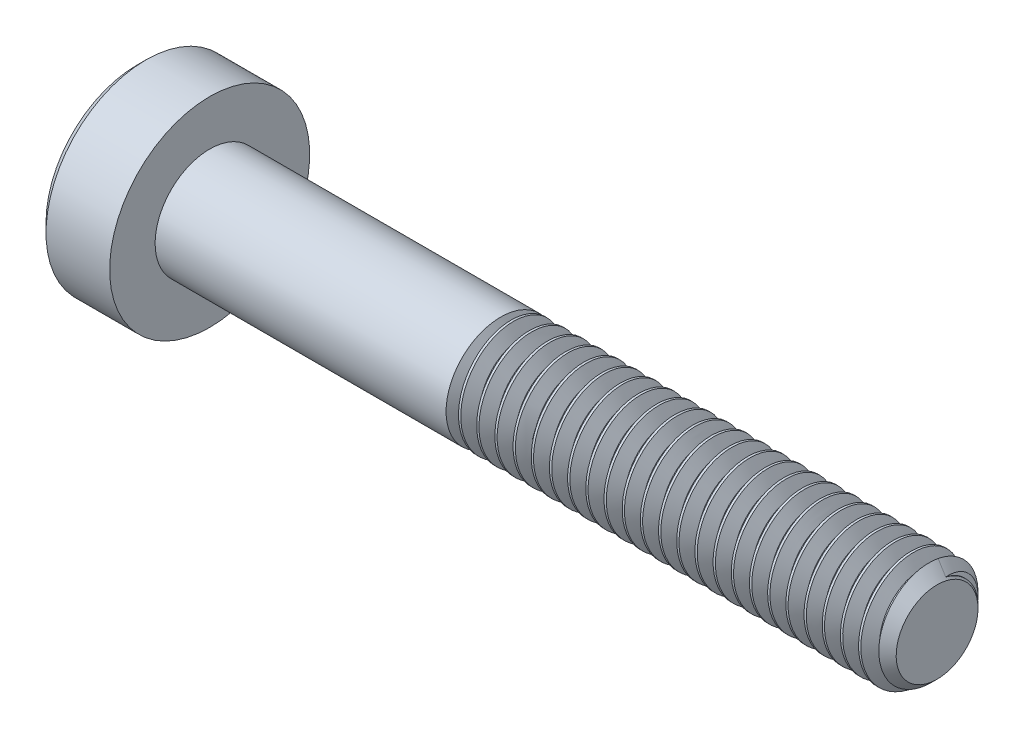
from build123d import *

# Parameters (mm, degrees)
SKETCH2_R           = 1.5
BOSS_EXTRUDE1_DEPTH = 12
CHAMFER1_SIZE       = 0.375
CUT_SWEEP1_PITCH    = 0.5
CUT_EXTRUDE1_DEPTH  = 1.62


with BuildPart() as part:
    # Sketch2 → Boss-Extrude1 (new body)
    with BuildSketch(Plane(origin=(10, 0, 0), x_dir=(0, 0, -1), z_dir=(1, 0, 0))):
        Circle(SKETCH2_R)
    extrude(amount=-BOSS_EXTRUDE1_DEPTH)

    # Chamfer1
    chamfer1_edges = [part.edges().sort_by_distance(p)[0] for p in [
        (10, 0, 1.5),
    ]]
    chamfer(chamfer1_edges, length=CHAMFER1_SIZE)

    # Cut-Sweep1: the profile of Sketch5 profile screwed along a right-hand helix of 25 turns, 6 arcs to a turn; built about Z, then put on its axis
    cut_sweep1_z = Axis((0, 0, 0), (0, 0, 1))
    cut_sweep1_corners = [(1.5003, 0, 0.218923205), (1.5003, 0, -0.218923205), (1.175240474, 0, -0.03125), (1.175240474, 0, 0.03125)]
    with BuildLine(mode=Mode.PRIVATE) as cut_sweep1_profile:
        Line(cut_sweep1_corners[0], cut_sweep1_corners[1])
        Line(cut_sweep1_corners[1], cut_sweep1_corners[2])
        Line(cut_sweep1_corners[2], cut_sweep1_corners[3])
        Line(cut_sweep1_corners[3], cut_sweep1_corners[0])
    cut_sweep1_cap = Face(cut_sweep1_profile.wire())
    cut_sweep1_turn_angles = [0, 30, 60, 90, 120, 150, 180, 210, 240, 270, 300, 330, 360]
    cut_sweep1_turn_weights = [1, 0.8660254037844387, 1, 0.8660254037844387, 1, 0.8660254037844387, 1, 0.8660254037844387, 1, 0.8660254037844387, 1, 0.8660254037844387, 1]
    cut_sweep1_turn_rails = [Edge.make_bspline([Vector(p[0], p[1], 0).rotate(cut_sweep1_z, cut_sweep1_turn_angles[k]) / cut_sweep1_turn_weights[k] + Vector(0, 0, p[2] + CUT_SWEEP1_PITCH * cut_sweep1_turn_angles[k] / 360) for k in range(13)], [0, 0, 0, 1, 1, 2, 2, 3, 3, 4, 4, 5, 5, 6, 6, 6], 2, cut_sweep1_turn_weights) for p in cut_sweep1_corners]
    cut_sweep1_turn_sides = [Face.make_surface_from_curves(cut_sweep1_turn_rails[p[0]], cut_sweep1_turn_rails[p[1]]) for p in [(0, 1), (1, 2), (2, 3), (3, 0)]]
    cut_sweep1 = Plane(origin=(10, 0, 0), x_dir=(0, 1, 0), z_dir=(-1, 0, 0)) * Solid(Shell([*[p.moved(Location((0, 0, CUT_SWEEP1_PITCH * i))) for i in range(25) for p in cut_sweep1_turn_sides], cut_sweep1_cap, cut_sweep1_cap.rotate(cut_sweep1_z, 9000).moved(Location((0, 0, CUT_SWEEP1_PITCH * 9000 / 360)))]))
    add(cut_sweep1, mode=Mode.SUBTRACT)

    # Sketch10 → Revolve2 (revolve)
    with BuildSketch(Plane.XY, mode=Mode.PRIVATE) as revolve2_sk:
        Polygon((-1.133974596, 0), (-2, 1.5), (-10, 1.5), (-10, 0), align=None)
    revolve(revolve2_sk.sketch.rotate(Axis((-10, 0, 0), (1, 0, 0)), 292.024312837), axis=Axis((-10, 0, 0), (1, 0, 0)))

    # Sketch6 → Revolve1 (revolve)
    with BuildSketch(Plane.XY, mode=Mode.PRIVATE) as revolve1_sk:
        Polygon((-11.75, 2.75), (-12, 2.5), (-12, 0), (-10, 0), (-10, 2.75), align=None)
    revolve(revolve1_sk.sketch.rotate(Axis((-10, 0, 0), (-1, 0, 0)), 67.975687163), axis=Axis((-10, 0, 0), (-1, 0, 0)))

    # Sketch4 → Cut-Extrude1 (cut)
    with BuildSketch(Plane(origin=(-12, 0, 0), x_dir=(0, 0, -1), z_dir=(1, 0, 0))):
        Polygon((0, 1.154700538), (-1, 0.577350269), (-1, -0.577350269), (0, -1.154700538), (1, -0.577350269), (1, 0.577350269), align=None)
    extrude(amount=CUT_EXTRUDE1_DEPTH, mode=Mode.SUBTRACT)

    # Cut-Extrude2 cone 1 section (through the dimple's axis) → Cut-Extrude2 (revolve, cut)
    with BuildSketch(Plane(origin=(-12, 0, 0), x_dir=(0, 0, 1), z_dir=(0, 1, 0))):
        Polygon((0, 0), (1.154700538, 0), (0, 1.154700538), align=None)
    revolve(axis=Axis((-12, 0, 0), (1, 0, 0)), mode=Mode.SUBTRACT)


solid = part.part
